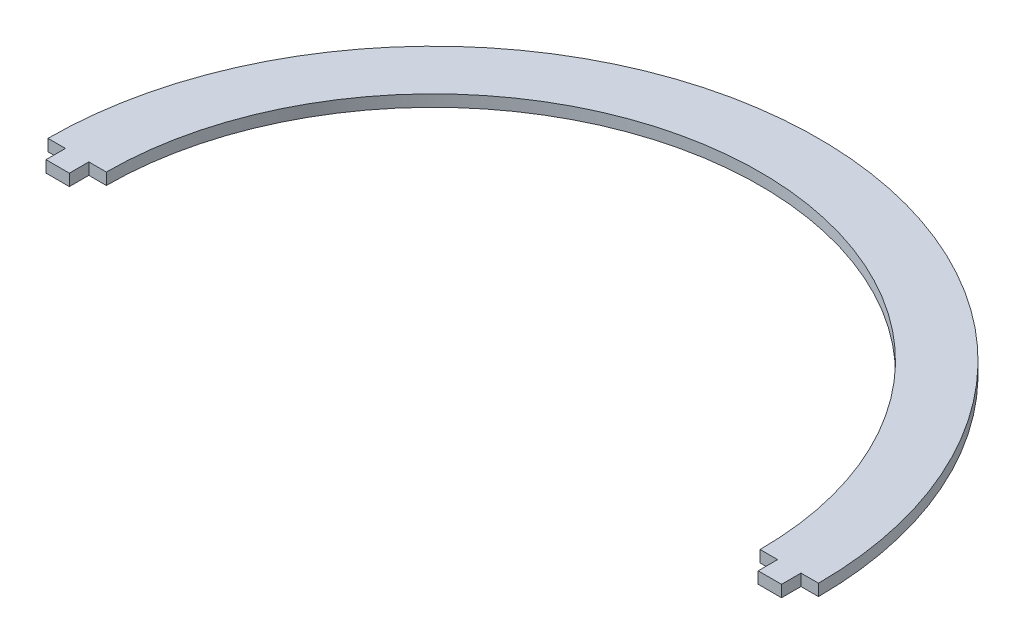
from build123d import *

# Parameters (mm, degrees)
BOSS_EXTRUDE1_DEPTH = 1.5


with BuildPart() as part:
    # Sketch1 → Boss-Extrude1 (new, symmetric)
    with BuildSketch(Plane(origin=(0, 0, 0), x_dir=(1, 0, 0), z_dir=(0, 1, 0))):
        with BuildLine():
            Line((-94.5, 0), (-88.5, 0))
            Line((-88.5, 0), (-88.5, 5))
            Line((-88.5, 5), (-84, 5))
            ThreePointArc((-84, 5), (0, 89), (84, 5))
            Line((84, 5), (88.5, 5))
            Line((88.5, 5), (88.5, 0))
            Line((88.5, 0), (94.5, 0))
            Line((94.5, 0), (94.5, 5))
            Line((94.5, 5), (99, 5))
            ThreePointArc((99, 5), (0, 104), (-99, 5))
            Line((-99, 5), (-94.5, 5))
            Line((-94.5, 5), (-94.5, 0))
        make_face()
    extrude(amount=BOSS_EXTRUDE1_DEPTH, both=True)


solid = part.part
